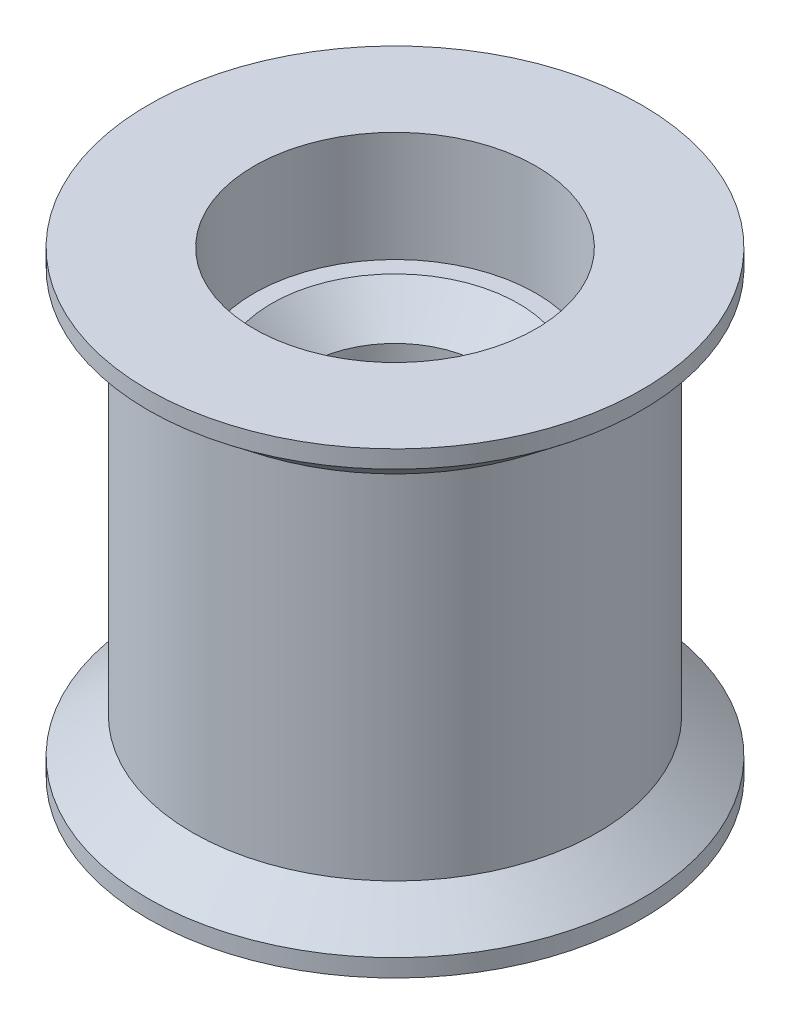
from build123d import *

# Parameters (mm, degrees)
CHAMFER1_SIZE = 1


with BuildPart() as part:
    # Sketch2 → Revolve1 (revolve)
    with BuildSketch(Plane(origin=(0, 0, 0), x_dir=(0, 0, -1), z_dir=(1, 0, 0))):
        Polygon((2.5, 0), (2.5, 3.375), (4, 3.375), (4, 6.5), (7, 6.5), (7, 6), (5.75, 5), (5.75, 0), align=None)
    revolve1 = revolve(axis=Axis((0, 0, 0), (0, 1, 0)))

    # Mirror1: Revolve1 across plane
    add(revolve1.mirror(Plane.ZX))

    # Chamfer1
    chamfer1_edges = [part.edges().sort_by_distance(p)[0] for p in [
        (0, -3.375, 2.5),
        (0, 3.375, 2.5),
    ]]
    chamfer(chamfer1_edges, length=CHAMFER1_SIZE)


solid = part.part
